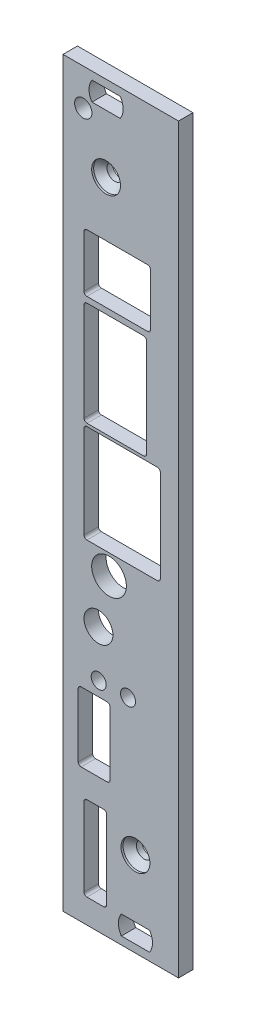
from build123d import *

# Parameters (mm, degrees)
SKETCH1_W                                      = 19.98
SKETCH1_H                                      = 128.4
BOSS_EXTRUDE1_DEPTH                            = 2.5
CUT_EXTRUDE1_DEPTH                             = 127.049239982
CUT_EXTRUDE2_DEPTH                             = 127.049239982
SKETCH4_W                                      = 3.9
SKETCH4_H                                      = 14.6
CUT_EXTRUDE3_DEPTH                             = 127.049239982
F_3_0_3_DIAMETER_HOLE1_D                       = 3
CSK_FOR_M2_5_FLAT_HEAD_MACHINE_SCREW1_AT_COUNT = 2
CSK_FOR_M2_5_FLAT_HEAD_MACHINE_SCREW1_AT_PITCH = 99.130249672
USB_DEPTH                                      = 127.049239982
SKETCH10_R                                     = 1.3
LEDS_DEPTH                                     = 127.049239982
SKETCH11_R                                     = 2.5
RESET_SWITCH_DEPTH                             = 127.049239982
SKETCH13_R                                     = 3
DISABLE_COMMS_DEPTH                            = 127.049239982
SKETCH14_W                                     = 13.2
SKETCH14_H                                     = 17
RJ45_DEPTH                                     = 127.049239982
SKETCH15_W                                     = 10.8
SKETCH15_H                                     = 18
OUTPUT_DEPTH                                   = 127.049239982
SKETCH16_W                                     = 11.5
SKETCH16_H                                     = 10
POWER_DEPTH                                    = 127.049239982
FILLETS_R                                      = 0.5


with BuildPart() as part:
    # Sketch1 → Boss-Extrude1 (new body)
    with BuildSketch(Plane.XY.offset(2.5)):
        with Locations((2.54, 61.2)):
            Rectangle(SKETCH1_W, SKETCH1_H)
    extrude(amount=-BOSS_EXTRUDE1_DEPTH)

    # Sketch2 → Cut-Extrude1 (cut, through all)
    with BuildSketch(Plane.XY.offset(2.5)):
        with BuildLine():
            Line((2.445403852, 124.05), (-2.445403852, 124.05))
            ThreePointArc((-2.445403852, 124.05), (-2.95, 122.4), (-2.445403852, 120.75))
            Line((-2.445403852, 120.75), (2.445403852, 120.75))
            ThreePointArc((2.445403852, 120.75), (2.95, 122.4), (2.445403852, 124.05))
        make_face()
    extrude(amount=-CUT_EXTRUDE1_DEPTH, mode=Mode.SUBTRACT)

    # Sketch3 → Cut-Extrude2 (cut, through all)
    with BuildSketch(Plane.XY.offset(2.5)):
        with BuildLine():
            Line((7.525403852, 1.65), (2.634596148, 1.65))
            ThreePointArc((2.634596148, 1.65), (2.13, 0), (2.634596148, -1.65))
            Line((2.634596148, -1.65), (7.525403852, -1.65))
            ThreePointArc((7.525403852, -1.65), (8.03, 0), (7.525403852, 1.65))
        make_face()
    extrude(amount=-CUT_EXTRUDE2_DEPTH, mode=Mode.SUBTRACT)

    # Sketch4 → Cut-Extrude3 (cut, through all)
    with BuildSketch(Plane(origin=(0, 0, 0), x_dir=(-1, 0, 0), z_dir=(0, 0, -1))):
        with Locations((1.87, 8.5)):
            Rectangle(SKETCH4_W, SKETCH4_H)
    extrude(amount=-CUT_EXTRUDE3_DEPTH, mode=Mode.SUBTRACT)

    # Ø3.0 (3) Diameter Hole1 (through all)
    with Locations(Plane.XY.offset(2.5)):
        with Locations((-3.95, 119.1)):
            Hole(F_3_0_3_DIAMETER_HOLE1_D / 2)

    # Sketch7 → CSK for M2.5 Flat Head Machine Screw1 (revolve, cut)
    with BuildSketch(Plane(origin=(5.08, 11.7, 2.5), x_dir=(0, -1, 0), z_dir=(1, 0, 0))):
        Polygon((0, 0), (0, 2.5), (1.35, 2.5), (1.35, 1.5), (2.5, 0.35), (2.5, 0), align=None)
    csk_for_m2_5_flat_head_machine_screw1 = revolve(axis=Axis((5.08, 11.7, 8.85), (0, 0, -1)), mode=Mode.SUBTRACT)

    # CSK for M2.5 Flat Head Machine Screw1 at: CSK for M2.5 Flat Head Machine Screw1 ×2
    with Locations(*[Vector(-0.05124570972853528, 0.9986860754183062, 0) * (i * CSK_FOR_M2_5_FLAT_HEAD_MACHINE_SCREW1_AT_PITCH) for i in range(1, CSK_FOR_M2_5_FLAT_HEAD_MACHINE_SCREW1_AT_COUNT)]):
        add(csk_for_m2_5_flat_head_machine_screw1, mode=Mode.SUBTRACT)

    # Sketch9 → USB (cut, through all)
    with BuildSketch(Plane.XY.offset(2.5)):
        Polygon((-3.82, 20.2), (0.68, 20.2), (0.68, 32.2), (-3.82, 32.2), (-4.82, 32.2), (-4.82, 20.2), align=None)
    extrude(amount=-USB_DEPTH, mode=Mode.SUBTRACT)

    # Sketch10 → LEDs (cut, through all)
    with BuildSketch(Plane.XY.offset(2.5)):
        with Locations((-1.28, 34.65)):
            Circle(SKETCH10_R)
        with Locations((3.8, 34.65)):
            Circle(SKETCH10_R)
    extrude(amount=-LEDS_DEPTH, mode=Mode.SUBTRACT)

    # Sketch11 → Reset switch (cut, through all)
    with BuildSketch(Plane.XY.offset(2.5)):
        with Locations((-1.32, 42.7)):
            Circle(SKETCH11_R)
    extrude(amount=-RESET_SWITCH_DEPTH, mode=Mode.SUBTRACT)

    # Sketch13 → Disable comms (cut, through all)
    with BuildSketch(Plane.XY.offset(2.5)):
        with Locations((0.505, 51.2)):
            Circle(SKETCH13_R)
    extrude(amount=-DISABLE_COMMS_DEPTH, mode=Mode.SUBTRACT)

    # Sketch14 → RJ45 (cut, through all)
    with BuildSketch(Plane.XY.offset(2.5)):
        with Locations((2.78, 63.2)):
            Rectangle(SKETCH14_W, SKETCH14_H)
    extrude(amount=-RJ45_DEPTH, mode=Mode.SUBTRACT)

    # Sketch15 → Output (cut, through all)
    with BuildSketch(Plane.XY.offset(2.5)):
        with Locations((1.58, 81.2)):
            Rectangle(SKETCH15_W, SKETCH15_H)
    extrude(amount=-OUTPUT_DEPTH, mode=Mode.SUBTRACT)

    # Sketch16 → Power (cut, through all)
    with BuildSketch(Plane.XY.offset(2.5)):
        with Locations((1.93, 96.2)):
            Rectangle(SKETCH16_W, SKETCH16_H)
    extrude(amount=-POWER_DEPTH, mode=Mode.SUBTRACT)

    # Fillets
    fillets_edges = [part.edges().sort_by_distance(p)[0] for p in [
        (0.68, 20.2, 1.25),
        (-4.82, 20.2, 1.25),
        (-4.82, 32.2, 1.25),
        (0.68, 32.2, 1.25),
        (0.08, 1.2, 1.25),
        (-3.82, 1.2, 1.25),
        (-3.82, 15.8, 1.25),
        (0.08, 15.8, 1.25),
        (9.38, 71.7, 1.25),
        (6.98, 90.2, 1.25),
        (7.68, 101.2, 1.25),
        (-3.82, 71.7, 1.25),
        (-3.82, 90.2, 1.25),
        (-3.82, 101.2, 1.25),
        (-3.82, 54.7, 1.25),
        (-3.82, 72.2, 1.25),
        (-3.82, 91.2, 1.25),
        (9.38, 54.7, 1.25),
        (6.98, 72.2, 1.25),
        (7.68, 91.2, 1.25),
    ]]
    fillet(fillets_edges, radius=FILLETS_R)


solid = part.part
